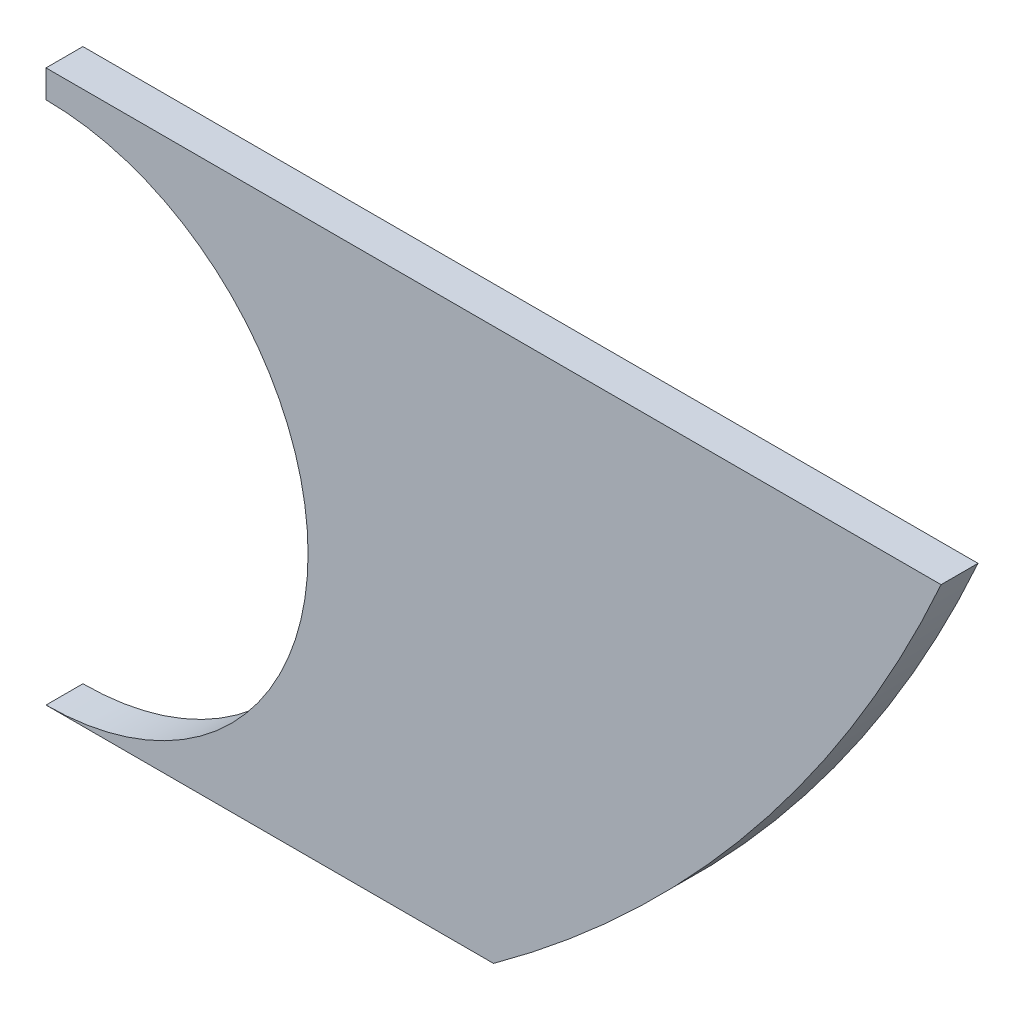
from build123d import *

# Parameters (mm, degrees)
SKETCH1_R               = 19.939
CIRCLE_EXTRUDE_DEPTH    = 2.54
SKETCH3_W               = 2.54
SKETCH3_H               = 39.878
RECTANGLE_EXTRUDE_DEPTH = 63.5
SKETCH2_R               = 18.034
CRICLE_CUT_DEPTH        = 2.54
SKETCH4_OUTSIDE_W       = 103.941
SKETCH4_OUTSIDE_H       = 60.38
SKETCH4_OUTSIDE_W_2     = 61.595
SKETCH4_OUTSIDE_H_2     = 37.973
FRAME_CUT_DEPTH         = 67.605294992
CUT_EXTRUDE4_DEPTH      = 65.791661084


with BuildPart() as part:
    # Sketch1 → circle extrude (new body)
    with BuildSketch(Plane.XY):
        Circle(SKETCH1_R)
    extrude(amount=CIRCLE_EXTRUDE_DEPTH)

    # Sketch3 → rectangle extrude (add)
    with BuildSketch(Plane(origin=(0, 0, 0), x_dir=(0, 0, -1), z_dir=(1, 0, 0))):
        with Locations((-1.27, 0)):
            Rectangle(SKETCH3_W, SKETCH3_H)
    extrude(amount=RECTANGLE_EXTRUDE_DEPTH)

    # Sketch2 → cricle cut (cut)
    with BuildSketch(Plane.XY.offset(2.54)):
        Circle(SKETCH2_R)
    extrude(amount=-CRICLE_CUT_DEPTH, mode=Mode.SUBTRACT)

    # Sketch4 outside → frame cut (cut, through all)
    with BuildSketch(Plane.XY.offset(2.54)):
        with Locations((21.7805, 0)):
            Rectangle(SKETCH4_OUTSIDE_W, SKETCH4_OUTSIDE_H)
        with Locations((30.7975, 0.9525)):
            Rectangle(SKETCH4_OUTSIDE_W_2, SKETCH4_OUTSIDE_H_2, mode=Mode.SUBTRACT)
    extrude(amount=-FRAME_CUT_DEPTH, mode=Mode.SUBTRACT)

    # Sketch8 → Cut-Extrude4 (cut, through all)
    with BuildSketch(Plane.XY.offset(2.54)):
        with BuildLine():
            Line((61.595, 19.939), (61.595, -18.034))
            Line((61.595, -18.034), (30.7975, -18.034))
            ThreePointArc((30.7975, -18.034), (48.695870145, -1.074783897), (61.595, 19.939))
        make_face()
    extrude(amount=-CUT_EXTRUDE4_DEPTH, mode=Mode.SUBTRACT)


solid = part.part
